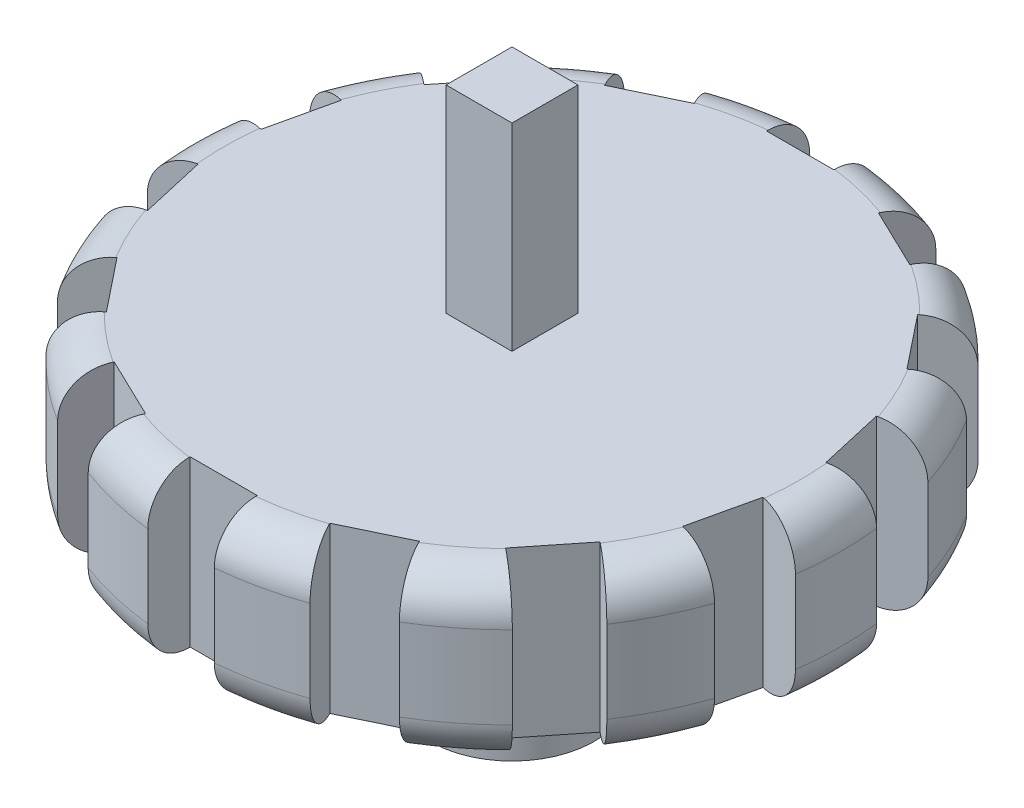
from build123d import *

# Parameters (mm, degrees)
SKETCH_1_R          = 4
EXTRUDE_1_DEPTH     = 2
SKETCH_2_W          = 0.8
SKETCH_2_H          = 0.8
EXTRUDE_2_DEPTH     = 2.4
SKETCH_3_R          = 1
EXTRUDE_3_DEPTH     = 2
FILLET_2_R          = 0.5
SKETCH_6_W          = 0.815145502
SKETCH_6_H          = 0.777523403
SKETCH_6_W_2        = 0.815145503
CUT_EXTRUDE_4_DEPTH = 2


with BuildPart() as part:
    # 草图1 → 凸台-拉伸1 (new body)
    with BuildSketch(Plane(origin=(0, 0, 0), x_dir=(1, 0, 0), z_dir=(0, 1, 0))):
        with Locations((-15.237247062, 0.4)):
            Circle(SKETCH_1_R)
    extrude(amount=EXTRUDE_1_DEPTH)

    # 草图2 → 凸台-拉伸2 (add)
    with BuildSketch(Plane(origin=(0, 2, 0), x_dir=(1, 0, 0), z_dir=(0, 1, 0))):
        with Locations((-15.237247062, 0.4)):
            Rectangle(SKETCH_2_W, SKETCH_2_H)
    extrude(amount=EXTRUDE_2_DEPTH)

    # 草图3 → 凸台-拉伸3 (add)
    with BuildSketch(Plane.XZ):
        with Locations((-15.237247062, -0.4)):
            Circle(SKETCH_3_R)
    extrude(amount=EXTRUDE_3_DEPTH)

    # 圆角2
    fillet_2_edges = [part.edges().sort_by_distance(p)[0] for p in [
        (-19.237247062, 0, -0.4),
        (-19.237247062, 2, -0.4),
    ]]
    fillet(fillet_2_edges, radius=FILLET_2_R)

    # 草图6 → 切除-拉伸4 (cut)
    with BuildSketch(Plane(origin=(0, 2, 0), x_dir=(1, 0, 0), z_dir=(0, 1, 0))):
        Polygon((-16.743060611, -3.579503319), (-16.40570585, -2.87897894), (-17.140126571, -2.525300561), (-17.477481332, -3.225824941), align=None)
        with Locations((-15.274869162, -3.449994913)):
            Rectangle(SKETCH_6_W, SKETCH_6_H)
        Polygon((-18.320579971, -2.532060587), (-17.712687696, -2.047282675), (-18.220922604, -1.409976258), (-18.828814879, -1.894754171), align=None)
        Polygon((-19.287407433, -0.903887296), (-18.529378166, -0.730872063), (-18.710765104, 0.06383604), (-19.468794372, -0.109179193), align=None)
        Polygon((-19.452050962, 0.982536865), (-18.694021695, 0.809521631), (-18.512634756, 1.604229734), (-19.270664023, 1.777244968), align=None)
        Polygon((-18.781900887, 2.753582455), (-18.174008613, 2.268804543), (-17.665773705, 2.90611096), (-18.273665979, 3.390888872), align=None)
        Polygon((-17.40968865, 4.058472176), (-17.072333889, 3.357947796), (-16.337913168, 3.711626175), (-16.675267929, 4.412150554), align=None)
        with Locations((-15.199624962, 4.249994913)):
            Rectangle(SKETCH_6_W_2, SKETCH_6_H)
        Polygon((-13.731433512, 4.379503319), (-14.068788274, 3.67897894), (-13.334367553, 3.325300561), (-12.997012792, 4.025824941), align=None)
        Polygon((-12.153914153, 3.332060587), (-12.761806427, 2.847282675), (-12.253571519, 2.209976258), (-11.645679245, 2.694754171), align=None)
        Polygon((-11.187086691, 1.703887296), (-11.945115958, 1.530872063), (-11.76372902, 0.73616396), (-11.005699752, 0.909179193), align=None)
        Polygon((-11.022443162, -0.182536865), (-11.780472429, -0.009521631), (-11.961859368, -0.804229734), (-11.2038301, -0.977244968), align=None)
        Polygon((-11.692593237, -1.953582455), (-12.300485511, -1.468804543), (-12.808720419, -2.10611096), (-12.200828144, -2.590888872), align=None)
        Polygon((-13.064805474, -3.258472176), (-13.402160235, -2.557947796), (-14.136580956, -2.911626175), (-13.799226194, -3.612150554), align=None)
    extrude(amount=-CUT_EXTRUDE_4_DEPTH, mode=Mode.SUBTRACT)


solid = part.part
